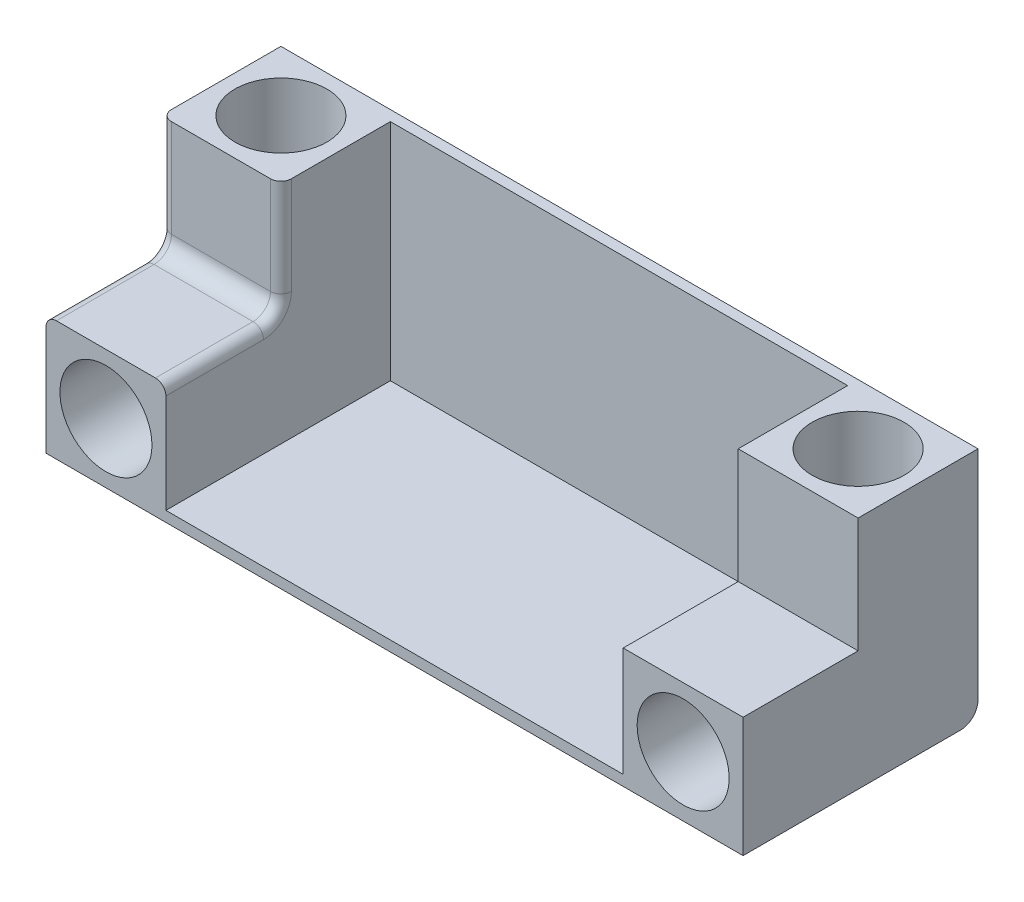
from build123d import *

# Parameters (mm, degrees)
SKETCH1_R           = 13.2
BOSS_EXTRUDE3_DEPTH = 5
SKETCH1_6_W         = 100
SKETCH1_6_H         = 55
SKETCH1_6_R         = 13.2
BOSS_EXTRUDE4_DEPTH = 55
SKETCH2_W           = 65.6
SKETCH2_H           = 52
CUT_EXTRUDE1_DEPTH  = 52
SKETCH3_R           = 13.2
CUT_EXTRUDE2_DEPTH  = 22.6
SKETCH4_W           = 20.6
SKETCH4_H           = 20.6
CUT_EXTRUDE4_DEPTH  = 39
SKETCH9_R           = 13.2
BOSS_EXTRUDE5_DEPTH = 12.4
BOSS_EXTRUDE7_START = 12.4
SKETCH10_R          = 13.2
BOSS_EXTRUDE7_DEPTH = 12.4
MIRROR1_START       = 30.398461356
MIRROR1_OUTLINE_R   = 13.2
MIRROR1_DEPTH       = 37.001538644
MIRROR1_2_OUTLINE_W = 100
MIRROR1_2_OUTLINE_H = 67.4
MIRROR1_2_OUTLINE_R = 13.2
MIRROR1_2_DEPTH     = 3
MIRROR1_3_OUTLINE_W = 34.4
MIRROR1_3_OUTLINE_H = 33
MIRROR1_3_DEPTH     = 4.001538644
MIRROR1_START_2     = 3
MIRROR1_4_OUTLINE_R = 13.2
MIRROR1_4_DEPTH     = 0.998461256
MIRROR1_START_3     = 3.998461256
MIRROR1_5_OUTLINE_R = 13.2
MIRROR1_5_DEPTH     = 26.4000001
MIRROR1_START_4     = 4.9
MIRROR1_6_OUTLINE_R = 13.2
MIRROR1_6_DEPTH     = 35
FILLET3_R           = 5
FILLET4_R           = 5
FILLET5_R           = 3
FILLET6_R           = 3


with BuildPart() as part:
    # Sketch1 → Boss-Extrude3 (new body)
    with BuildSketch(Plane(origin=(0, 0, 0), x_dir=(1, 0, 0), z_dir=(0, 1, 0))):
        with Locations(Location((-32.8, 10.3, 0), (0, 0, 270))):
            Circle(SKETCH1_R)
    boss_extrude3 = extrude(amount=BOSS_EXTRUDE3_DEPTH)

    # Sketch1<6> → Boss-Extrude4 (add)
    with BuildSketch(Plane(origin=(0, 0, 0), x_dir=(1, 0, 0), z_dir=(0, 1, 0))):
        Rectangle(SKETCH1_6_W, SKETCH1_6_H)
        with Locations(Location((-32.8, 10.3, 0), (0, 0, 270))):
            Circle(SKETCH1_6_R, mode=Mode.SUBTRACT)
    extrude(amount=BOSS_EXTRUDE4_DEPTH)

    # Sketch2 → Cut-Extrude1 (cut)
    with BuildSketch(Plane(origin=(0, 55, 0), x_dir=(1, 0, 0), z_dir=(0, 1, 0))):
        with Locations((17.2, -1.5)):
            Rectangle(SKETCH2_W, SKETCH2_H)
    extrude(amount=-CUT_EXTRUDE1_DEPTH, mode=Mode.SUBTRACT)

    # Sketch3 → Cut-Extrude2 (cut)
    with BuildSketch(Plane.XY.offset(27.5)):
        with Locations((-32.801538644, 17.198461356)):
            Circle(SKETCH3_R)
    extrude(amount=-CUT_EXTRUDE2_DEPTH, mode=Mode.SUBTRACT)

    # Sketch4 → Cut-Extrude4 (cut)
    with BuildSketch(Plane.ZY.offset(50)):
        with Locations((17.2, 44.7)):
            Rectangle(SKETCH4_W, SKETCH4_H)
    extrude(amount=-CUT_EXTRUDE4_DEPTH, mode=Mode.SUBTRACT)

    # Sketch9 → Boss-Extrude5 (add)
    with BuildSketch(Plane(origin=(0, 55, 0), x_dir=(1, 0, 0), z_dir=(0, 1, 0))):
        Polygon((-50, -6.9), (-15.6, -6.9), (-15.6, 24.5), (50, 24.5), (50, 27.5), (-50, 27.5), align=None)
        with Locations(Location((-32.8, 10.3, 0), (0, 0, 270))):
            Circle(SKETCH9_R, mode=Mode.SUBTRACT)
    extrude(amount=BOSS_EXTRUDE5_DEPTH)

    # Sketch10 → Boss-Extrude7 (add)
    with BuildSketch(Plane.XY.offset(27.5).offset(BOSS_EXTRUDE7_START)):
        Polygon((-15.6, 3), (-15.6, 34.4), (-50, 34.4), (-50, 0), (50, 0), (50, 3), align=None)
        with Locations((-32.801538644, 17.198461356)):
            Circle(SKETCH10_R, mode=Mode.SUBTRACT)
    extrude(amount=-BOSS_EXTRUDE7_DEPTH)

    # Mirror1: read off the stored shape, not the designer's step
    # Mirror1 outline → Mirror1 (add)
    with BuildSketch(Plane(origin=(0, 0, 0), x_dir=(1, 0, 0), z_dir=(0, 1, 0)).offset(MIRROR1_START)):
        Polygon((150, -6.9), (150, 27.5), (50, 27.5), (50, 24.5), (115.6, 24.5), (115.6, -6.9), align=None)
        with Locations((132.8, 10.3)):
            Circle(MIRROR1_OUTLINE_R, mode=Mode.SUBTRACT)
    extrude(amount=MIRROR1_DEPTH)

    # Mirror1 2 outline → Mirror1 2 (add)
    with BuildSketch(Plane(origin=(0, 0, 0), x_dir=(1, 0, 0), z_dir=(0, 1, 0))):
        with Locations((100, -6.2)):
            Rectangle(MIRROR1_2_OUTLINE_W, MIRROR1_2_OUTLINE_H)
        with Locations((132.8, 10.3)):
            Circle(MIRROR1_2_OUTLINE_R, mode=Mode.SUBTRACT)
    extrude(amount=MIRROR1_2_DEPTH)

    # Mirror1 3 outline → Mirror1 3 (add)
    with BuildSketch(Plane(origin=(0, 0, 0), x_dir=(1, 0, 0), z_dir=(0, 1, 0)).offset(MIRROR1_START)):
        with Locations((132.8, -23.4)):
            Rectangle(MIRROR1_3_OUTLINE_W, MIRROR1_3_OUTLINE_H)
    extrude(amount=MIRROR1_3_DEPTH)

    # Mirror1 4 outline → Mirror1 4 (add)
    with BuildSketch(Plane(origin=(0, 0, 0), x_dir=(1, 0, 0), z_dir=(0, 1, 0)).offset(MIRROR1_START_2)):
        Polygon((150, 27.5), (50, 27.5), (50, 24.5), (115.6, 24.5), (115.6, -39.9), (150, -39.9), align=None)
        with Locations((132.8, 10.3)):
            Circle(MIRROR1_4_OUTLINE_R, mode=Mode.SUBTRACT)
    extrude(amount=MIRROR1_4_DEPTH)

    # Mirror1 5 outline → Mirror1 5 (add)
    with BuildSketch(Plane(origin=(0, 0, 0), x_dir=(1, 0, 0), z_dir=(0, 1, 0)).offset(MIRROR1_START_3)):
        Polygon((150, -39.9), (150, 27.5), (50, 27.5), (50, 24.5), (115.6, 24.5), (115.6, -39.9), align=None)
        with Locations((132.8, 10.3)):
            Circle(MIRROR1_5_OUTLINE_R, mode=Mode.SUBTRACT)
    extrude(amount=MIRROR1_5_DEPTH)

    # Mirror1 6 outline → Mirror1 6 (cut)
    with BuildSketch(Plane.XY.offset(MIRROR1_START_4)):
        with Locations((132.801538644, 17.198461356)):
            Circle(MIRROR1_6_OUTLINE_R)
    extrude(amount=MIRROR1_6_DEPTH, mode=Mode.SUBTRACT)

    # Mirror2: Boss-Extrude3 across plane
    add(boss_extrude3.mirror(Plane.ZY.offset(-50)))

    # Fillet3
    fillet3_edges = [part.edges().sort_by_distance(p)[0] for p in [
        (50, 0, -27.5),
    ]]
    fillet(fillet3_edges, radius=FILLET3_R)

    # Fillet4
    fillet4_edges = [part.edges().sort_by_distance(p)[0] for p in [
        (-32.8, 34.4, 6.9),
    ]]
    fillet(fillet4_edges, radius=FILLET4_R)

    # Fillet5
    fillet5_edges = [part.edges().sort_by_distance(p)[0] for p in [
        (-50, 34.4, 25.9),
        (-50, 35.864466094, 8.364466094),
        (-50, 53.4, 6.9),
    ]]
    fillet(fillet5_edges, radius=FILLET5_R)

    # Fillet6
    fillet6_edges = [part.edges().sort_by_distance(p)[0] for p in [
        (-15.6, 34.4, 25.9),
        (-15.6, 35.864466094, 8.364466094),
        (-15.6, 53.4, 6.9),
    ]]
    fillet(fillet6_edges, radius=FILLET6_R)


solid = part.part
